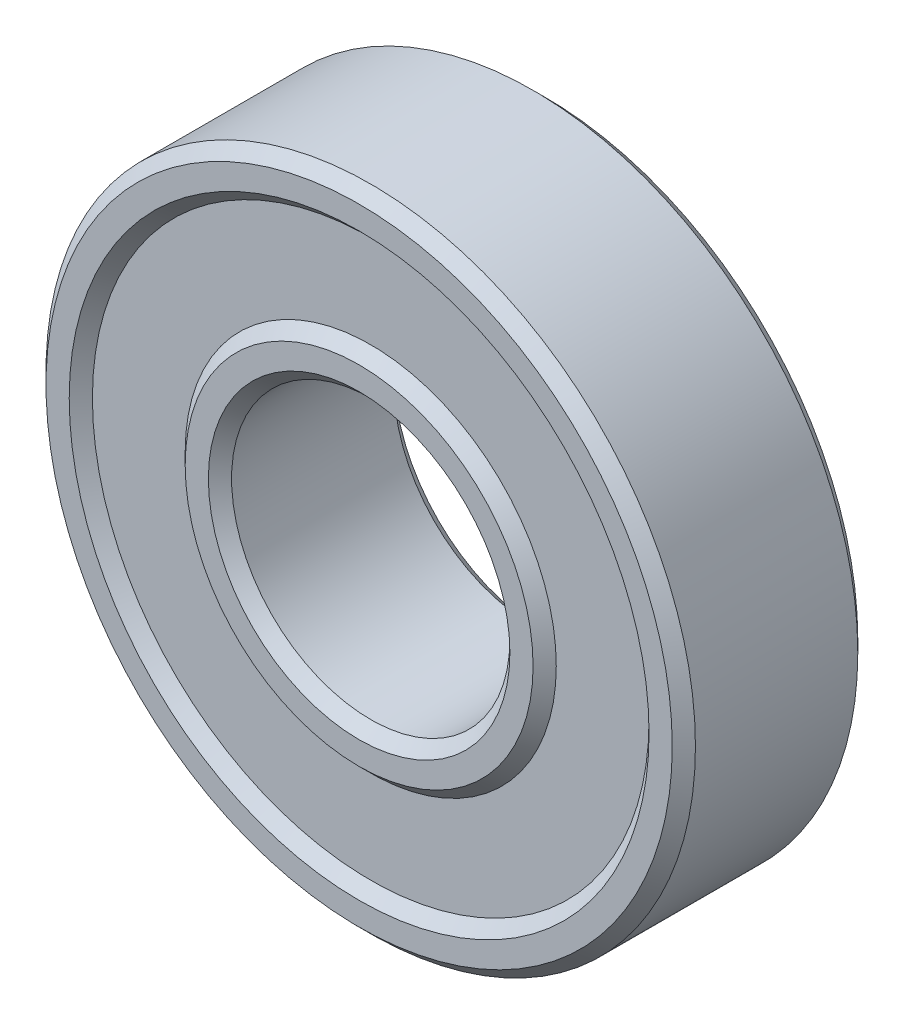
from build123d import *

# Parameters (mm, degrees)
SKETCH1_R           = 14
SKETCH1_R_2         = 6
BOSS_EXTRUDE1_DEPTH = 4
CUT_EXTRUDE1_START  = -4
SKETCH1_3_R         = 12
SKETCH1_3_R_2       = 8
CUT_EXTRUDE1_DEPTH  = 0.5
CUT_EXTRUDE2_START  = 3.5
SKETCH1_4_R         = 12
SKETCH1_4_R_2       = 8
CUT_EXTRUDE2_DEPTH  = 0.5
CHAMFER1_SIZE       = 0.5


with BuildPart() as part:
    # Sketch1 → Boss-Extrude1 (new, symmetric)
    with BuildSketch(Plane.XY):
        Circle(SKETCH1_R)
        Circle(SKETCH1_R_2, mode=Mode.SUBTRACT)
    extrude(amount=BOSS_EXTRUDE1_DEPTH, both=True)

    # Sketch1<3> → Cut-Extrude1 (cut)
    with BuildSketch(Plane.XY.offset(CUT_EXTRUDE1_START)):
        Circle(SKETCH1_3_R)
        Circle(SKETCH1_3_R_2, mode=Mode.SUBTRACT)
    extrude(amount=CUT_EXTRUDE1_DEPTH, mode=Mode.SUBTRACT)

    # Sketch1<4> → Cut-Extrude2 (cut)
    with BuildSketch(Plane.XY.offset(CUT_EXTRUDE2_START)):
        Circle(SKETCH1_4_R)
        Circle(SKETCH1_4_R_2, mode=Mode.SUBTRACT)
    extrude(amount=CUT_EXTRUDE2_DEPTH, mode=Mode.SUBTRACT)

    # Chamfer1
    chamfer1_edges = [part.edges().sort_by_distance(p)[0] for p in [
        (-8, 0, -4),
        (-12, 0, -4),
        (-14, 0, -4),
        (-12, 0, 4),
        (-8, 0, 4),
        (-14, 0, 4),
        (-6, 0, -4),
        (-6, 0, 4),
    ]]
    chamfer(chamfer1_edges, length=CHAMFER1_SIZE - 0.0001)  # a hair under: the kernel refuses the full size


solid = part.part
